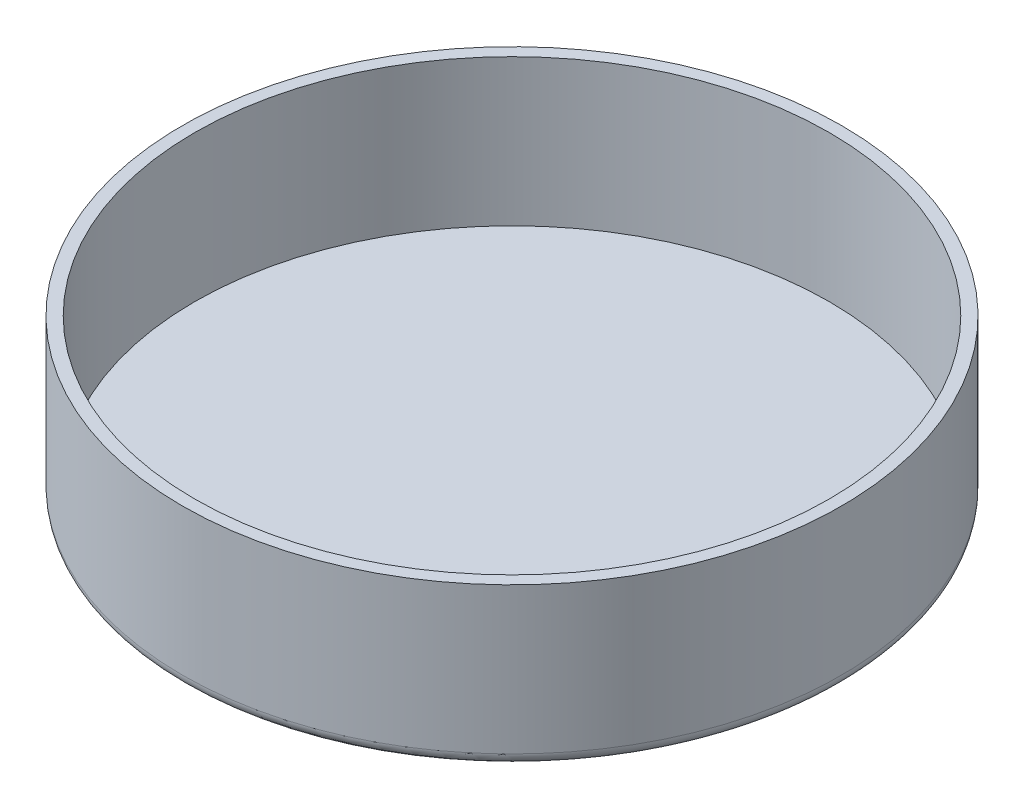
from build123d import *

# Parameters (mm, degrees)
SKETCH1_R           = 27
SKETCH1_R_2         = 26
BOSS_EXTRUDE1_DEPTH = 12
BOSS_EXTRUDE2_START = 1
SKETCH2_R           = 27
BOSS_EXTRUDE2_DEPTH = 1
SKETCH3_R           = 25.5
SKETCH3_R_2         = 24.5
BOSS_EXTRUDE3_DEPTH = 0.6
FILLET1_R           = 1
FILLET2_R           = 0.5


with BuildPart() as part:
    # Sketch1 → Boss-Extrude1 (new body)
    with BuildSketch(Plane(origin=(0, 0, 0), x_dir=(1, 0, 0), z_dir=(0, 1, 0))):
        with Locations(Location((0, 0, 0), (0, 0, 270))):
            Circle(SKETCH1_R)
        with Locations(Location((0, 0, 0), (0, 0, 270))):
            Circle(SKETCH1_R_2, mode=Mode.SUBTRACT)
    extrude(amount=BOSS_EXTRUDE1_DEPTH)

    # Sketch2 → Boss-Extrude2 (add)
    with BuildSketch(Plane.XZ.offset(BOSS_EXTRUDE2_START)):
        with Locations(Location((0, 0, 0), (0, 0, 270))):
            Circle(SKETCH2_R)
    extrude(amount=-BOSS_EXTRUDE2_DEPTH)

    # Sketch3 → Boss-Extrude3 (add)
    with BuildSketch(Plane.XZ.offset(1)):
        with Locations(Location((0, 0, 0), (0, 0, 270))):
            Circle(SKETCH3_R)
        with Locations(Location((0, 0, 0), (0, 0, 270))):
            Circle(SKETCH3_R_2, mode=Mode.SUBTRACT)
    extrude(amount=BOSS_EXTRUDE3_DEPTH)

    # Fillet1
    fillet1_edges = [part.edges().sort_by_distance(p)[0] for p in [
        (0, -1, 27),
    ]]
    fillet(fillet1_edges, radius=FILLET1_R - 0.0001)  # a hair under: the kernel refuses the full size

    # Fillet2
    fillet2_edges = [part.edges().sort_by_distance(p)[0] for p in [
        (0, -1.6, 25.5),
        (0, -1.6, 24.5),
    ]]
    fillet(fillet2_edges, radius=FILLET2_R - 0.0001)  # a hair under: the kernel refuses the full size


solid = part.part
